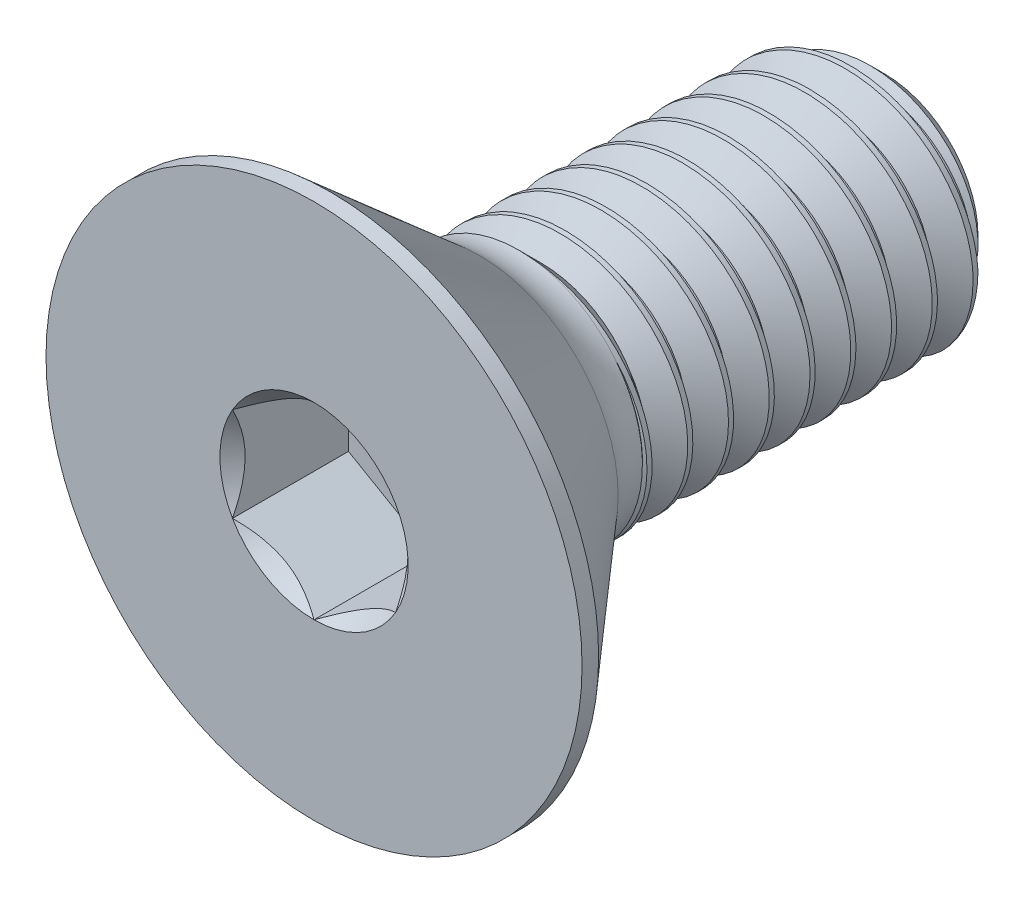
from build123d import *

# Parameters (mm, degrees)
SKETCH1_W          = 11.1125
SKETCH1_H          = 2.413
CHAMFER1_SIZE      = 0.5953125
CUT_SWEEP1_PITCH   = 0.79375
CUT_EXTRUDE2_DEPTH = 2.25806


with BuildPart() as part:
    # Sketch1 → Revolve1 (revolve)
    with BuildSketch(Plane(origin=(0, 0, 0), x_dir=(0, 0, -1), z_dir=(1, 0, 0))):
        with Locations((5.55625, 1.2065)):
            Rectangle(SKETCH1_W, SKETCH1_H)
    revolve(axis=Axis((0, 0, -11.1125), (0, 0, 1)))

    # Chamfer1
    chamfer1_edges = [part.edges().sort_by_distance(p)[0] for p in [
        (0, -2.413, -11.1125),
    ]]
    chamfer(chamfer1_edges, length=CHAMFER1_SIZE)

    # Cut-Sweep1: the profile of Sketch2 profile screwed along a right-hand helix of 14 turns, 8 arcs to a turn; built about Z, then put on its axis
    cut_sweep1_z = Axis((0, 0, 0), (0, 0, 1))
    cut_sweep1_corners = [(2.4136, 0, 0.00034641), (2.4136, 0, -0.69487766), (1.897444252, 0, -0.396875), (1.897444252, 0, -0.29765625)]
    with BuildLine(mode=Mode.PRIVATE) as cut_sweep1_profile:
        Line(cut_sweep1_corners[0], cut_sweep1_corners[1])
        Line(cut_sweep1_corners[1], cut_sweep1_corners[2])
        Line(cut_sweep1_corners[2], cut_sweep1_corners[3])
        Line(cut_sweep1_corners[3], cut_sweep1_corners[0])
    cut_sweep1_cap = Face(cut_sweep1_profile.wire())
    cut_sweep1_turn_angles = [0, 22.5, 45, 67.5, 90, 112.5, 135, 157.5, 180, 202.5, 225, 247.5, 270, 292.5, 315, 337.5, 360]
    cut_sweep1_turn_weights = [1, 0.9238795325112867, 1, 0.9238795325112867, 1, 0.9238795325112867, 1, 0.9238795325112867, 1, 0.9238795325112867, 1, 0.9238795325112867, 1, 0.9238795325112867, 1, 0.9238795325112867, 1]
    cut_sweep1_turn_rails = [Edge.make_bspline([Vector(p[0], p[1], 0).rotate(cut_sweep1_z, cut_sweep1_turn_angles[k]) / cut_sweep1_turn_weights[k] + Vector(0, 0, p[2] + CUT_SWEEP1_PITCH * cut_sweep1_turn_angles[k] / 360) for k in range(17)], [0, 0, 0, 1, 1, 2, 2, 3, 3, 4, 4, 5, 5, 6, 6, 7, 7, 8, 8, 8], 2, cut_sweep1_turn_weights) for p in cut_sweep1_corners]
    cut_sweep1_turn_sides = [Face.make_surface_from_curves(cut_sweep1_turn_rails[p[0]], cut_sweep1_turn_rails[p[1]]) for p in [(0, 1), (1, 2), (2, 3), (3, 0)]]
    cut_sweep1 = Plane(origin=(0, 0, -11.1125), x_dir=(0, 1, 0), z_dir=(0, 0, 1)) * Solid(Shell([*[p.moved(Location((0, 0, CUT_SWEEP1_PITCH * i))) for i in range(14) for p in cut_sweep1_turn_sides], cut_sweep1_cap, cut_sweep1_cap.rotate(cut_sweep1_z, 5040).moved(Location((0, 0, CUT_SWEEP1_PITCH * 5040 / 360)))]))
    add(cut_sweep1, mode=Mode.SUBTRACT)


with BuildPart() as body_2:
    # Sketch7 → Revolve2 (revolve)
    with BuildSketch(Plane(origin=(0, 0, 0), x_dir=(0, 0, -1), z_dir=(1, 0, 0)), mode=Mode.PRIVATE) as revolve2_sk:
        with BuildLine():
            Line((0, 5.2197), (0.32258, 5.2197))
            Line((0.32258, 5.2197), (3.2258, 2.695969357))
            ThreePointArc((3.2258, 2.695969357), (3.578633365, 2.486055564), (3.982635924, 2.413))
            Line((3.982635924, 2.413), (3.982635924, 0))
            Line((3.982635924, 0), (0, 0))
            Line((0, 0), (0, 5.2197))
        make_face()
    revolve(revolve2_sk.sketch.rotate(Axis((0, 0, 0), (0, 0, -1)), 180), axis=Axis((0, 0, 0), (0, 0, -1)))

    # Boss-Extrude1 cone 1 section (through the dimple's axis) → Boss-Extrude1 (revolve)
    with BuildSketch(Plane(origin=(0, 0, -3.982635924), x_dir=(0, -1, 0), z_dir=(1, 0, 0))):
        Polygon((0, 0), (2.413, 0), (0, 2.413), align=None)
    revolve(axis=Axis((0, 0, -3.982635924), (0, 0, -1)))

    # Combine1: union part
    add(part.part)

    # Sketch5 → Cut-Extrude2 (cut)
    with BuildSketch(Plane.XY):
        Polygon((1.5875, -0.916543552), (1.5875, 0.916543552), (0, 1.833087105), (-1.5875, 0.916543552), (-1.5875, -0.916543552), (0, -1.833087105), align=None)
    extrude(amount=-CUT_EXTRUDE2_DEPTH, mode=Mode.SUBTRACT)

    # Cut-Extrude3 cone 1 section (through the dimple's axis) → Cut-Extrude3 (revolve, cut)
    with BuildSketch(Plane(origin=(0, 0, 0), x_dir=(0, -1, 0), z_dir=(1, 0, 0))):
        Polygon((0, 0), (1.833087105, 0), (0, 1.833087105), align=None)
    revolve(axis=Axis((0, 0, 0), (0, 0, -1)), mode=Mode.SUBTRACT)


solid = body_2.part
